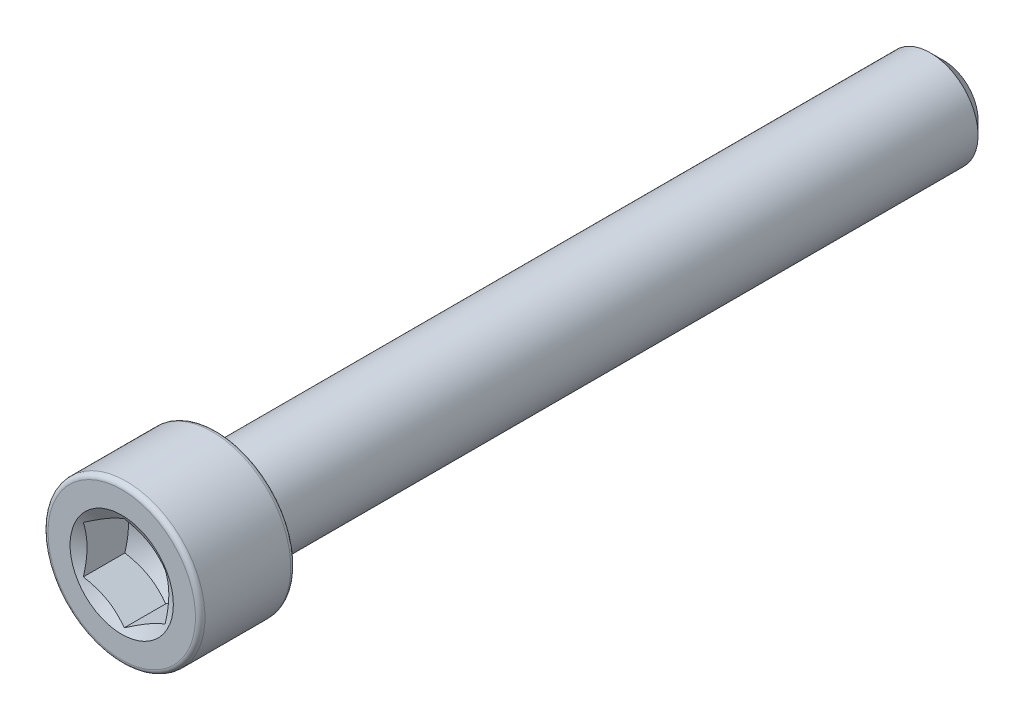
from build123d import *

# Parameters (mm, degrees)
CUT_EXTRUDE1_REACH = 38.559
CUT_EXTRUDE1_START = 17.9578


with BuildPart() as part:
    # Sketch2 → Revolve1 (revolve)
    with BuildSketch(Plane(origin=(0, 0, 0), x_dir=(0, 0, -1), z_dir=(1, 0, 0))):
        with BuildLine():
            Line((17.9578, 0), (17.9578, 1.4874875))
            Line((17.9578, 1.4874875), (17.3624875, 2.0828))
            Line((17.3624875, 2.0828), (-13.7922, 2.0828))
            Line((-13.7922, 2.0828), (-13.7922, 3.22072))
            ThreePointArc((-13.7922, 3.22072), (-13.8532038, 3.3679962), (-14.00048, 3.429))
            Line((-14.00048, 3.429), (-17.74952, 3.429))
            ThreePointArc((-17.74952, 3.429), (-17.8967962, 3.3679962), (-17.9578, 3.22072))
            Line((-17.9578, 3.22072), (-17.9578, 1.7859375))
            Line((-17.9578, 1.7859375), (-15.875, 1.7859375))
            Line((-15.875, 1.7859375), (-14.843888504, 0))
            Line((-14.843888504, 0), (17.9578, 0))
        make_face()
    revolve(axis=Axis((0, 0, -17.9578), (0, 0, 1)))

    # Cut-Extrude1: up to this cone (the profile starts inside it)
    cut_extrude1_end = Plane(origin=(0, 0, 17.9578), z_dir=(0, 0, 1)).offset(-3.113910496) * Cone(1.732e-06, 82.387359904, 47.566363418, align=(Align.CENTER, Align.CENTER, Align.MIN), mode=Mode.PRIVATE)
    # Sketch3 → Cut-Extrude1 (cut, up to the surface)
    with BuildSketch(Plane.XY.offset(CUT_EXTRUDE1_START), mode=Mode.PRIVATE) as cut_extrude1_sk1:
        Polygon((-1.7859375, 1.031111496), (-1.7859375, -1.031111496), (0, -2.062222993), (1.7859375, -1.031111496), (1.7859375, 1.031111496), (0, 2.062222993), align=None)
    cut_extrude1_tool1 = extrude(cut_extrude1_sk1.sketch, amount=-CUT_EXTRUDE1_REACH, mode=Mode.PRIVATE) & cut_extrude1_end
    add(cut_extrude1_tool1.solids().sort_by_distance((0, 0, 17.9578))[0], mode=Mode.SUBTRACT)

    # Cut-Extrude2 cone 1 section (through the dimple's axis) → Cut-Extrude2 (revolve, cut)
    with BuildSketch(Plane(origin=(0, 0, 17.9578), x_dir=(0, -1, 0), z_dir=(1, 0, 0))):
        Polygon((0, 0), (2.255305827, 0), (0, 1.302101426), align=None)
    revolve(axis=Axis((0, 0, 17.9578), (0, 0, -1)), mode=Mode.SUBTRACT)


solid = part.part
